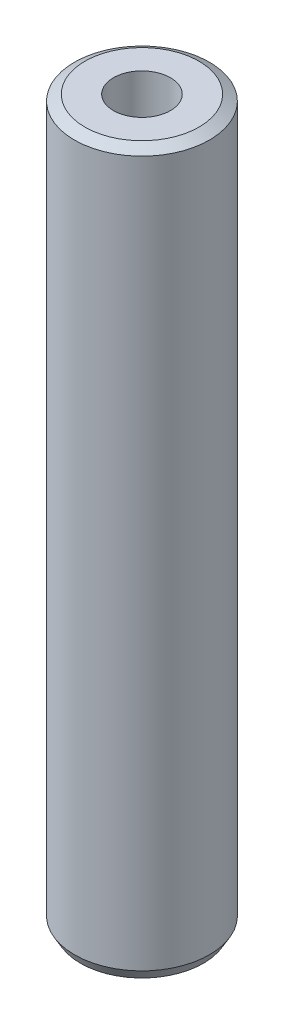
from build123d import *
from OCP.BRepFilletAPI import BRepFilletAPI_MakeChamfer

# Parameters (mm, degrees)
SKETCH1_R           = 27.5
BOSS_EXTRUDE1_DEPTH = 294.168901876
SKETCH2_R           = 11.619221972
CUT_EXTRUDE1_DEPTH  = 297.728567601
CHAMFER1_SIZE       = 2.451994542
CHAMFER1_SIZE2      = 4.246979126


with BuildPart() as part:
    # Sketch1 → Boss-Extrude1 (new body)
    with BuildSketch(Plane(origin=(0, 0, 0), x_dir=(1, 0, 0), z_dir=(0, 1, 0))):
        Circle(SKETCH1_R)
    extrude(amount=BOSS_EXTRUDE1_DEPTH)

    # Sketch2 → Cut-Extrude1 (cut, through all)
    with BuildSketch(Plane(origin=(0, 0, 0), x_dir=(1, 0, 0), z_dir=(0, 1, 0))):
        Circle(SKETCH2_R)
    extrude(amount=CUT_EXTRUDE1_DEPTH, mode=Mode.SUBTRACT)

    # Chamfer1: one chamfer whose edges measure the first distance from different faces: ONE call of the kernel's chamfer builder (chamfer() names one face for all edges)
    chamfer1_edges_1 = [part.edges().sort_by_distance(p)[0] for p in [
        (-27.5, 294.168901876, 0),
    ]]
    chamfer1_side_1 = [part.faces().sort_by_distance(p)[0] for p in [
        (-27.5, 147.084450938, 0),
    ]]
    chamfer1_edges_2 = [part.edges().sort_by_distance(p)[0] for p in [
        (-27.5, 0, 0),
    ]]
    chamfer1_side_2 = [part.faces().sort_by_distance(p)[0] for p in [
        (-26.722182541, 0, 0),
    ]]
    chamfer1 = BRepFilletAPI_MakeChamfer(part.part.solid().wrapped)
    for e in chamfer1_edges_1:
        chamfer1.Add(CHAMFER1_SIZE, CHAMFER1_SIZE2, e.wrapped, chamfer1_side_1[0].wrapped)  # the first distance lies on this face
    for e in chamfer1_edges_2:
        chamfer1.Add(CHAMFER1_SIZE, CHAMFER1_SIZE2, e.wrapped, chamfer1_side_2[0].wrapped)  # the first distance lies on this face
    add(Compound.cast(chamfer1.Shape()), mode=Mode.REPLACE)


solid = part.part
